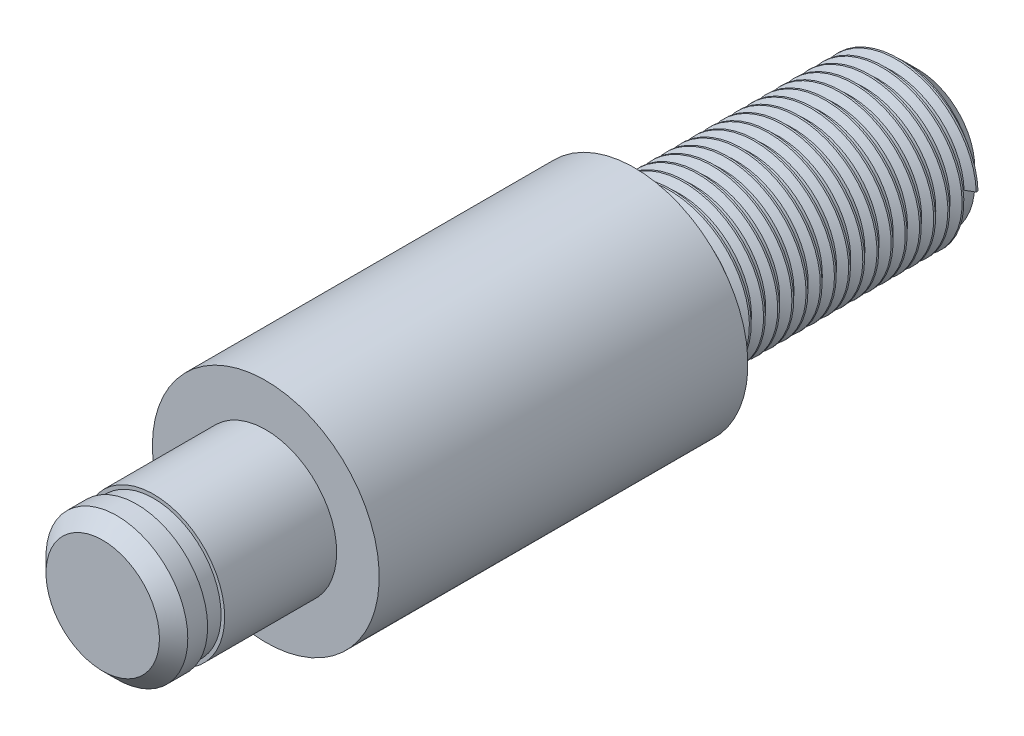
from build123d import *

# Parameters (mm, degrees)
SKETCH1_R           = 8
BOSS_EXTRUDE1_DEPTH = 26
SKETCH2_R           = 5
BOSS_EXTRUDE2_DEPTH = 11.5
BOSS_EXTRUDE3_START = 20
SKETCH3_R           = 5
BOSS_EXTRUDE3_DEPTH = 20
CHAMFER1_SIZE       = 1
CHAMFER2_SIZE       = 1
THREAD1_PITCH       = 1
SKETCH6_W           = 0.25
SKETCH6_H           = 1.2


with BuildPart() as part:
    # Sketch1 → Boss-Extrude1 (new body)
    with BuildSketch(Plane.XY):
        with Locations(Location((0, 0, 0), (0, 0, 180))):
            Circle(SKETCH1_R)
    extrude(amount=BOSS_EXTRUDE1_DEPTH)

    # Sketch2 → Boss-Extrude2 (add)
    with BuildSketch(Plane.XY.offset(26)):
        Circle(SKETCH2_R)
    extrude(amount=BOSS_EXTRUDE2_DEPTH)

    # Sketch3 → Boss-Extrude3 (add)
    with BuildSketch(Plane(origin=(0, 0, 0), x_dir=(-1, 0, 0), z_dir=(0, 0, -1)).offset(BOSS_EXTRUDE3_START)):
        with Locations(Location((0, 0, 0), (0, 0, 180))):
            Circle(SKETCH3_R)
    extrude(amount=-BOSS_EXTRUDE3_DEPTH)

    # Chamfer1
    chamfer1_edges = [part.edges().sort_by_distance(p)[0] for p in [
        (-5, 0, 37.5),
    ]]
    chamfer(chamfer1_edges, length=CHAMFER1_SIZE)

    # Chamfer2
    chamfer2_edges = [part.edges().sort_by_distance(p)[0] for p in [
        (-5, 0, -20),
    ]]
    chamfer(chamfer2_edges, length=CHAMFER2_SIZE)

    # Thread1: the profile of Thread Profile1 profile screwed along a right-hand helix of 18.5 turns, 8 arcs to a turn; built about Z, then put on its axis
    thread1_z = Axis((0, 0, 0), (0, 0, 1))
    thread1_corners = [(4.9997, 0, -0.000173205), (5.541265875, 0, 0.312499999), (5.541265875, 0, 0.437499999), (4.9997, 0, 0.750173202)]
    with BuildLine(mode=Mode.PRIVATE) as thread1_profile:
        Line(thread1_corners[0], thread1_corners[1])
        Line(thread1_corners[1], thread1_corners[2])
        Line(thread1_corners[2], thread1_corners[3])
        Line(thread1_corners[3], thread1_corners[0])
    thread1_cap = Face(thread1_profile.wire())
    thread1_turn_angles = [0, 22.5, 45, 67.5, 90, 112.5, 135, 157.5, 180, 202.5, 225, 247.5, 270, 292.5, 315, 337.5, 360]
    thread1_turn_weights = [1, 0.9238795325112867, 1, 0.9238795325112867, 1, 0.9238795325112867, 1, 0.9238795325112867, 1, 0.9238795325112867, 1, 0.9238795325112867, 1, 0.9238795325112867, 1, 0.9238795325112867, 1]
    thread1_turn_rails = [Edge.make_bspline([Vector(p[0], p[1], 0).rotate(thread1_z, thread1_turn_angles[k]) / thread1_turn_weights[k] + Vector(0, 0, p[2] + THREAD1_PITCH * thread1_turn_angles[k] / 360) for k in range(17)], [0, 0, 0, 1, 1, 2, 2, 3, 3, 4, 4, 5, 5, 6, 6, 7, 7, 8, 8, 8], 2, thread1_turn_weights) for p in thread1_corners]
    thread1_turn_sides = [Face.make_surface_from_curves(thread1_turn_rails[p[0]], thread1_turn_rails[p[1]]) for p in [(0, 1), (1, 2), (2, 3), (3, 0)]]
    thread1_last_angles = [6480, 6502.5, 6525, 6547.5, 6570, 6592.5, 6615, 6637.5, 6660]
    thread1_last_weights = [1, 0.9238795325112867, 1, 0.9238795325112867, 1, 0.9238795325112867, 1, 0.9238795325112867, 1]
    thread1_last_rails = [Edge.make_bspline([Vector(p[0], p[1], 0).rotate(thread1_z, thread1_last_angles[k]) / thread1_last_weights[k] + Vector(0, 0, p[2] + THREAD1_PITCH * thread1_last_angles[k] / 360) for k in range(9)], [0, 0, 0, 1, 1, 2, 2, 3, 3, 4, 4, 4], 2, thread1_last_weights) for p in thread1_corners]
    thread1_last_sides = [Face.make_surface_from_curves(thread1_last_rails[p[0]], thread1_last_rails[p[1]]) for p in [(0, 1), (1, 2), (2, 3), (3, 0)]]
    thread1 = Plane(origin=(0, 0, -19), x_dir=(1, 0, 0), z_dir=(0, 0, 1)) * Solid(Shell([*[p.moved(Location((0, 0, THREAD1_PITCH * i))) for i in range(18) for p in thread1_turn_sides], *thread1_last_sides, thread1_cap, thread1_cap.rotate(thread1_z, 6660).moved(Location((0, 0, THREAD1_PITCH * 6660 / 360)))]))
    add(thread1)

    # Sketch6 → Cut-Revolve1 (revolve, cut)
    with BuildSketch(Plane(origin=(0, 0, 0), x_dir=(1, 0, 0), z_dir=(0, 1, 0)), mode=Mode.PRIVATE) as cut_revolve1_sk:
        with Locations((-4.875, -34.5)):
            Rectangle(SKETCH6_W, SKETCH6_H)
    revolve(cut_revolve1_sk.sketch.rotate(Axis((0, 0, 37.5), (0, 0, -1)), 180), axis=Axis((0, 0, 37.5), (0, 0, -1)), mode=Mode.SUBTRACT)


solid = part.part
